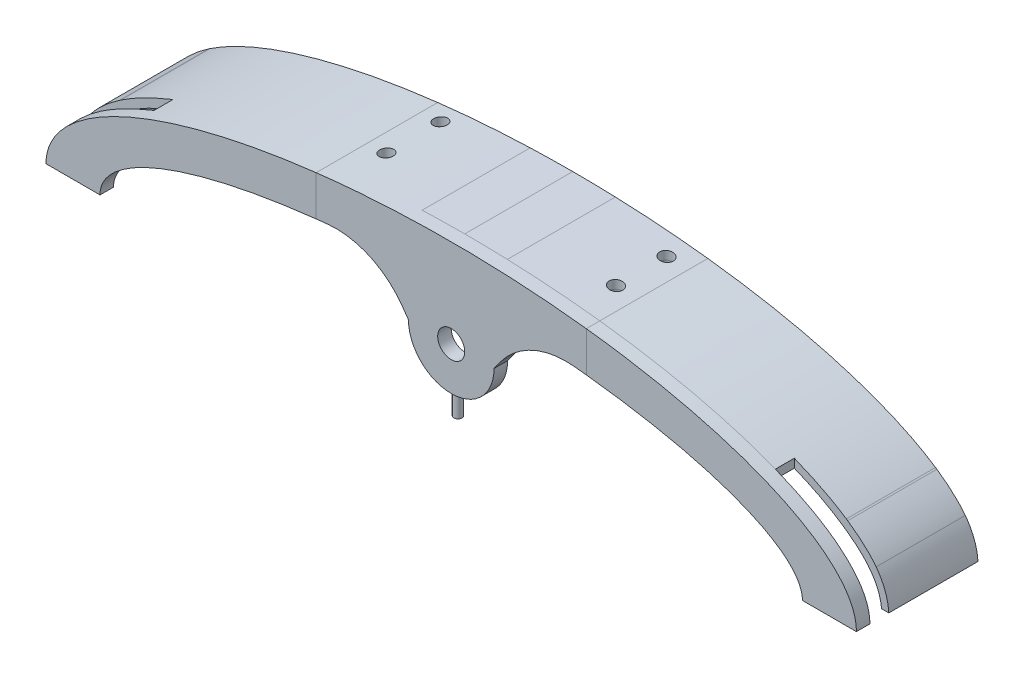
from build123d import *
from build123d.topology import SkipClean

# Parameters (mm, degrees)
ESQUISSE1_RX             = 150
ESQUISSE1_RY             = 50
BOSS_EXTRU_2_DEPTH       = 5
ESQUISSE2_RX             = 130
ESQUISSE2_RY             = 35
ENL_V_MAT_EXTRU_1_DEPTH  = 5
ESQUISSE3_W              = 338.580259568
ESQUISSE3_H              = 56.63953583
ENL_V_MAT_EXTRU_2_DEPTH  = 5
BOSS_EXTRU_3_DEPTH       = 5
CONG_1_R                 = 30
ESQUISSE5_R              = 5
ENL_V_MAT_EXTRU_3_DEPTH  = 5
BOSS_EXTRU_4_START       = -45
BOSS_EXTRU_4_DEPTH       = 40
ESQUISSE7_W              = 35
ESQUISSE7_H              = 7
ENL_V_MAT_EXTRU_5_DEPTH  = 164.09506445
BOSS_EXTRU_5_DEPTH       = 10
BOSS_EXTRU_5_DEPTH_BACK  = 7
ESQUISSE10_R             = 1.5
BOSS_EXTRU_10_REACH      = 164.2
ESQUISSE14_W             = 30
ESQUISSE14_H             = 33
BOSS_EXTRU_11_REACH      = 164.2
ESQUISSE16_W             = 30
ESQUISSE16_H             = 33
ENL_V_START              = -8.189441
ESQUISSE17_R             = 2.5
ENL_V_MAT_EXTRU_6_DEPTH  = 8.189441
FRACTIONNER2_OUTLINE_R   = 5
FRACTIONNER2_DEPTH       = 5
FRACTIONNER2_START       = -29.665741794
FRACTIONNER2_2_DEPTH     = 13.665741692
FRACTIONNER2_START_2     = -11.000004517
FRACTIONNER2_3_DEPTH     = 11.000004517
FRACTIONNER2_START_3     = -40
FRACTIONNER2_4_DEPTH     = 3.999999898
FRACTIONNER2_START_4     = -36.000000102
FRACTIONNER2_5_DEPTH     = 24.999995585
FRACTIONNER2_START_5     = 44.609756602
FRACTIONNER2_6_OUTLINE_R = 2.5
FRACTIONNER2_6_DEPTH     = 3.579684203
FRACTIONNER2_START_6     = -7
FRACTIONNER2_7_OUTLINE_R = 1.5
FRACTIONNER2_7_DEPTH     = 8.413447498
FRACTIONNER2_START_7     = -151
FRACTIONNER2_8_OUTLINE_W = 59
FRACTIONNER2_8_OUTLINE_H = 49
FRACTIONNER2_8_DEPTH     = 201
FRACTIONNER2_9_DEPTH     = 33
FRACTIONNER2_10_DEPTH    = 5
FRACTIONNER2_11_DEPTH    = 7


with BuildPart() as part:
    # Esquisse1 → Boss.-Extru.2 (new body)
    with BuildSketch(Plane.XY):
        with Locations((0, 0)):
            Ellipse(ESQUISSE1_RX, ESQUISSE1_RY)
    extrude(amount=BOSS_EXTRU_2_DEPTH)

    # Esquisse2 → Enlèv. mat.-Extru.1 (cut)
    with BuildSketch(Plane.XY.offset(5)):
        with Locations(Location((0, 0), (0, 0, 0))):
            Ellipse(ESQUISSE2_RX, ESQUISSE2_RY)
    extrude(amount=-ENL_V_MAT_EXTRU_1_DEPTH, mode=Mode.SUBTRACT)

    # Esquisse3 → Enlèv. mat.-Extru.2 (cut)
    with BuildSketch(Plane.XY.offset(5)):
        with Locations((-3.424514499, -28.319767915)):
            Rectangle(ESQUISSE3_W, ESQUISSE3_H)
    extrude(amount=-ENL_V_MAT_EXTRU_2_DEPTH, mode=Mode.SUBTRACT)

    # Esquisse4 → Boss.-Extru.3 (add)
    with BuildSketch(Plane.XY):
        with BuildLine():
            Line((15.845174987, 17.29157867), (28, 34.178525387))
            Line((28, 34.178525387), (-2.664875754, 44.275774322))
            Line((-2.664875754, 44.275774322), (-28, 34.178525387))
            Line((-28, 34.178525387), (-15.845243945, 17.095155839))
            ThreePointArc((-15.845243945, 17.095155839), (0.098211421, 1.342593988), (15.845174987, 17.29157867))
        make_face()
    extrude(amount=BOSS_EXTRU_3_DEPTH)

    # Congé1
    cong_1_edges = [part.edges().sort_by_distance(p)[0] for p in [
        (-28, 34.178525387, 2.5),
        (28, 34.178525387, 2.5),
    ]]
    fillet(cong_1_edges, radius=CONG_1_R)

    # Esquisse5 → Enlèv. mat.-Extru.3 (cut)
    with BuildSketch(Plane.XY.offset(5)):
        with Locations((0, 17.187804431)):
            Circle(ESQUISSE5_R)
    extrude(amount=-ENL_V_MAT_EXTRU_3_DEPTH, mode=Mode.SUBTRACT)

    # Boss.-Extru.4: read off the stored shape, not the designer's step
    # Boss.-Extru.4 outline → Boss.-Extru.4 (add)
    with BuildSketch(Plane.XY.offset(5).offset(BOSS_EXTRU_4_START)):
        with BuildLine():
            Line((0, 46.600242681), (0, 50))
            add(Edge.make_bspline(
                [(-15.761304085, 49.723213105), (-10.503685826, 49.900095186), (-5.247397008, 49.988568578), (0, 50)],
                knots=[0.90535686, 0.90535686, 0.90535686, 0.90535686, 1, 1, 1, 1], degree=3))
            add(Edge.make_bspline(
                [(-15.761304085, 49.723213105), (-97.594631494, 46.841036), (-134.274226107, 22.287096923)],
                knots=[1.685330257, 1.685330257, 1.685330257, 2.665492765, 2.665492765, 2.665492765], degree=2, weights=[0.96040199, 0.80429143, 0.876265347]))
            add(Edge.make_bspline(
                [(-134.779349014, 21.945708462), (-134.611328638, 22.060205738), (-134.442952588, 22.173999189), (-134.274226107, 22.287096923)],
                knots=[0.164934742, 0.164934742, 0.164934742, 0.164934742, 0.168550755, 0.168550755, 0.168550755, 0.168550755], degree=3))
            add(Edge.make_bspline(
                [(-134.779349014, 21.945708462), (-141.498923293, 17.360353105), (-145.300907362, 12.417041693)],
                knots=[2.67290709, 2.67290709, 2.67290709, 2.87528115, 2.87528115, 2.87528115], degree=2, weights=[0.877367275, 0.892583949, 0.917523824]))
            add(Edge.make_bspline(
                [(-150, 0), (-149.69407062, 4.850426726), (-147.918855057, 8.918503287), (-145.300907362, 12.417041693)],
                knots=[0, 0, 0, 0, 0.079709913, 0.079709913, 0.079709913, 0.079709913], degree=3))
            Line((-150, 0), (-147.297229878, 0))
            add(Edge.make_bspline(
                [(-147.297229878, 0), (-146.55190637, 8.121087352), (-134.103124611, 20.593757039), (-110.284334551, 31.468274657), (-65.554837533, 44.155968032), (-27.868629981, 46.563681345), (0, 46.600242681)],
                knots=[0, 0, 0, 0, 0.14174318, 0.308701525, 0.4831217, 1, 1, 1, 1], degree=3))
        make_face()
    boss_extru_4 = extrude(amount=BOSS_EXTRU_4_DEPTH)

    # Symétrie1: Boss.-Extru.4 across plane
    add(boss_extru_4.mirror(Plane(origin=(0, 0, -40), x_dir=(0, 0, 1), z_dir=(-1, 0, 0))))

    # Esquisse7 → Enlèv. mat.-Extru.5 (cut, through all)
    with BuildSketch(Plane(origin=(0, 0, 0), x_dir=(1, 0, 0), z_dir=(0, 1, 0))):
        with Locations((-132.5, 3.5)):
            Rectangle(ESQUISSE7_W, ESQUISSE7_H)
    enl_v_mat_extru_5 = extrude(amount=ENL_V_MAT_EXTRU_5_DEPTH, mode=Mode.SUBTRACT)

    # Symétrie2: Enlèv. mat.-Extru.5 across plane
    add(enl_v_mat_extru_5.mirror(Plane(origin=(0, 0, 0), x_dir=(0, 0, 1), z_dir=(1, 0, 0))), mode=Mode.SUBTRACT)

    # Esquisse10 → Boss.-Extru.5 (add, two sides: drawn at the far end of the back side and taken through both)
    with BuildSketch(Plane(origin=(0, 0, 0), x_dir=(1, 0, 0), z_dir=(0, 1, 0)).offset(-BOSS_EXTRU_5_DEPTH_BACK)):
        with Locations(Location((0, -2.5, 0), (0, 0, 270))):
            Circle(ESQUISSE10_R)
    extrude(amount=BOSS_EXTRU_5_DEPTH + BOSS_EXTRU_5_DEPTH_BACK)


with BuildPart() as body_2:

    # Esquisse14 → Boss.-Extru.10 (new, up to next)
    with BuildSketch(Plane(origin=(0, 40, 0), x_dir=(-1, 0, 0), z_dir=(0, -1, 0)), mode=Mode.PRIVATE) as boss_extru_10_sk1:
        with Locations((50, 23.5)):
            Rectangle(ESQUISSE14_W, ESQUISSE14_H)
    boss_extru_10_tool1 = extrude(boss_extru_10_sk1.sketch, amount=-BOSS_EXTRU_10_REACH, mode=Mode.PRIVATE) - part.part
    add(boss_extru_10_tool1.solids().sort_by_distance((-50, 40, -23.5))[0])


with BuildPart() as body_3:

    # Esquisse16 → Boss.-Extru.11 (new, up to next)
    with BuildSketch(Plane(origin=(0, 40, 0), x_dir=(-1, 0, 0), z_dir=(0, -1, 0)), mode=Mode.PRIVATE) as boss_extru_11_sk1:
        with Locations((-50, 23.5)):
            Rectangle(ESQUISSE16_W, ESQUISSE16_H)
    boss_extru_11_tool1 = extrude(boss_extru_11_sk1.sketch, amount=-BOSS_EXTRU_11_REACH, mode=Mode.PRIVATE) - part.part
    add(boss_extru_11_tool1.solids().sort_by_distance((50, 40, -23.5))[0])


with BuildPart() as enl_v_mat_extru_6_tool:
    # Esquisse17 → Enlèv. mat.-Extru.6 (new body)
    with BuildSketch(Plane.XZ.offset(-40).offset(ENL_V_START)):
        with Locations(Location((-42.5, -13.5, 0), (0, 0, 270))):
            Circle(ESQUISSE17_R)
        with Locations(Location((42.5, -13.5, 0), (0, 0, 270))):
            Circle(ESQUISSE17_R)
        with Locations(Location((42.5, -32.165737277, 0), (0, 0, 270))):
            Circle(ESQUISSE17_R)
        with Locations(Location((-42.5, -33.5, 0), (0, 0, 270))):
            Circle(ESQUISSE17_R)
    extrude(amount=ENL_V_MAT_EXTRU_6_DEPTH)


with BuildPart() as part_1:
    add(part.part)

    # Enlèv. mat.-Extru.6: cut by enl_v_mat_extru_6_tool
    add(enl_v_mat_extru_6_tool.part, mode=Mode.SUBTRACT)

    # Fractionner2 8 outline → Fractionner2 8 (cut)
    with BuildSketch(Plane.YZ.offset(FRACTIONNER2_START_7)):
        with Locations((22.5, -17.5)):
            Rectangle(FRACTIONNER2_8_OUTLINE_W, FRACTIONNER2_8_OUTLINE_H)
    extrude(amount=FRACTIONNER2_8_DEPTH, mode=Mode.SUBTRACT)


with BuildPart() as body_2_1:
    add(body_2.part)

    # Enlèv. mat.-Extru.6: cut by enl_v_mat_extru_6_tool
    add(enl_v_mat_extru_6_tool.part, mode=Mode.SUBTRACT)


with BuildPart() as body_3_1:
    add(body_3.part)

    # Enlèv. mat.-Extru.6: cut by enl_v_mat_extru_6_tool
    add(enl_v_mat_extru_6_tool.part, mode=Mode.SUBTRACT)


with BuildPart() as body_4:
    # Fractionner2: read off the stored shape, not the designer's step
    # Fractionner2 outline → Fractionner2 (new body)
    # profile 1 of 4: a face of its own
    with BuildSketch(Plane.XY):
        with BuildLine():
            Line((50, 44.092852893), (50, 47.140452079))
            add(Edge.make_bspline(
                [(15.761304085, 49.723213105), (33.337120261, 49.104191289), (50, 47.140452079)],
                knots=[1.676066008, 1.676066008, 1.676066008, 1.910633236, 1.910633236, 1.910633236], degree=2, weights=[1, 0.993130157, 1]))
            add(Edge.make_bspline(
                [(15.761304085, 49.723213105), (10.503685826, 49.900095186), (5.247397008, 49.988568578), (0, 50)],
                knots=[0.90535686, 0.90535686, 0.90535686, 0.90535686, 1, 1, 1, 1], degree=3))
            add(Edge.make_bspline(
                [(-15.761304085, 49.723213105), (-10.503685826, 49.900095186), (-5.247397008, 49.988568578), (0, 50)],
                knots=[0.90535686, 0.90535686, 0.90535686, 0.90535686, 1, 1, 1, 1], degree=3))
            add(Edge.make_bspline(
                [(-15.761304085, 49.723213105), (-33.337120261, 49.104191289), (-50, 47.140452079)],
                knots=[1.67514731, 1.67514731, 1.67514731, 1.910633236, 1.910633236, 1.910633236], degree=2, weights=[0.974100704, 0.980185104, 1]))
            Line((-50, 47.140452079), (-50, 44.092852893))
            add(Edge.make_bspline(
                [(-50, 44.092852893), (-33.398629858, 45.92748367), (-16.644198061, 46.578406871), (0, 46.600242681)],
                knots=[0.691300763, 0.691300763, 0.691300763, 0.691300763, 1, 1, 1, 1], degree=3))
            add(Edge.make_bspline(
                [(50, 44.092852893), (33.398629858, 45.92748367), (16.644198061, 46.578406871), (0, 46.600242681)],
                knots=[0.691300763, 0.691300763, 0.691300763, 0.691300763, 1, 1, 1, 1], degree=3))
        make_face()
    # profile 2 of 4: a face of its own
    with BuildSketch(Plane.XY):
        with BuildLine():
            Line((50, 32.307692308), (50, 44.092852893))
            add(Edge.make_bspline(
                [(50, 44.092852893), (33.398629858, 45.92748367), (16.644198061, 46.578406871), (0, 46.600242681)],
                knots=[0.691300763, 0.691300763, 0.691300763, 0.691300763, 1, 1, 1, 1], degree=3))
            add(Edge.make_bspline(
                [(-50, 44.092852893), (-33.398629858, 45.92748367), (-16.644198061, 46.578406871), (0, 46.600242681)],
                knots=[0.691300763, 0.691300763, 0.691300763, 0.691300763, 1, 1, 1, 1], degree=3))
            Line((-50, 44.092852893), (-50, 32.307692308))
            add(Edge.make_bspline(
                [(-45.59362734, 32.77681016), (-47.812693857, 32.553063189), (-50, 32.307692308)],
                knots=[1.929136381, 1.929136381, 1.929136381, 1.965587446, 1.965587446, 1.965587446], degree=2, weights=[1, 0.99983392, 1]))
            ThreePointArc((-45.59362734, 32.77681016), (-30.188335703, 30.247513293), (-18.139796917, 20.320123596))
            Line((-18.139796917, 20.320123596), (-15.845243945, 17.095155839))
            ThreePointArc((-15.845243945, 17.095155839), (0.098211422, 1.342593988), (15.845174987, 17.29157867))
            Line((15.845174987, 17.29157867), (18.128919268, 20.464431257))
            ThreePointArc((18.128919268, 20.464431257), (30.152776058, 30.290300146), (45.47858312, 32.788393309))
            add(Edge.make_bspline(
                [(50, 32.307692308), (47.755985725, 32.559424678), (45.47858312, 32.788393309)],
                knots=[1.176005207, 1.176005207, 1.176005207, 1.213401086, 1.213401086, 1.213401086], degree=2, weights=[1, 0.999825199, 1]))
        make_face()
        with Locations((0, 17.187804431)):
            Circle(FRACTIONNER2_OUTLINE_R, mode=Mode.SUBTRACT)
    # profile 3 of 4: a face of its own
    with BuildSketch(Plane.XY):
        with BuildLine():
            add(Edge.make_bspline(
                [(15.761304085, 49.723213105), (10.503685826, 49.900095186), (5.247397008, 49.988568578), (0, 50)],
                knots=[0.90535686, 0.90535686, 0.90535686, 0.90535686, 1, 1, 1, 1], degree=3))
            add(Edge.make_bspline(
                [(15.761304085, 49.723213105), (7.902525197, 50), (0, 50)],
                knots=[1.466445343, 1.466445343, 1.466445343, 1.570796327, 1.570796327, 1.570796327], degree=2, weights=[0.974100704, 0.971404521, 0.971404521]))
        make_face()
    # profile 4 of 4: a face of its own
    with BuildSketch(Plane.XY):
        with BuildLine():
            add(Edge.make_bspline(
                [(-15.761304085, 49.723213105), (-10.503685826, 49.900095186), (-5.247397008, 49.988568578), (0, 50)],
                knots=[0.90535686, 0.90535686, 0.90535686, 0.90535686, 1, 1, 1, 1], degree=3))
            add(Edge.make_bspline(
                [(0, 50), (-7.902525197, 50), (-15.761304085, 49.723213105)],
                knots=[1.570796327, 1.570796327, 1.570796327, 1.67514731, 1.67514731, 1.67514731], degree=2, weights=[0.971404521, 0.971404521, 0.974100704]))
        make_face()
    extrude(amount=FRACTIONNER2_DEPTH)

    # Fractionner2 2 outline → Fractionner2 2 (add)
    with BuildSketch(Plane.XY.offset(FRACTIONNER2_START)):
        with BuildLine():
            Line((50, 44.092852893), (50, 47.140452079))
            add(Edge.make_bspline(
                [(15.761304085, 49.723213105), (33.337120261, 49.104191289), (50, 47.140452079)],
                knots=[1.676066008, 1.676066008, 1.676066008, 1.910633236, 1.910633236, 1.910633236], degree=2, weights=[1, 0.993130157, 1]))
            add(Edge.make_bspline(
                [(15.761304085, 49.723213105), (10.503685826, 49.900095186), (5.247397008, 49.988568578), (0, 50)],
                knots=[0.90535686, 0.90535686, 0.90535686, 0.90535686, 1, 1, 1, 1], degree=3))
            add(Edge.make_bspline(
                [(-15.761304085, 49.723213105), (-10.503685826, 49.900095186), (-5.247397008, 49.988568578), (0, 50)],
                knots=[0.90535686, 0.90535686, 0.90535686, 0.90535686, 1, 1, 1, 1], degree=3))
            add(Edge.make_bspline(
                [(-15.761304085, 49.723213105), (-33.337120261, 49.104191289), (-50, 47.140452079)],
                knots=[1.67514731, 1.67514731, 1.67514731, 1.910633236, 1.910633236, 1.910633236], degree=2, weights=[0.974100704, 0.980185104, 1]))
            Line((-50, 47.140452079), (-50, 44.092852893))
            add(Edge.make_bspline(
                [(-50, 44.092852893), (-33.398629858, 45.92748367), (-16.644198061, 46.578406871), (0, 46.600242681)],
                knots=[0.691300763, 0.691300763, 0.691300763, 0.691300763, 1, 1, 1, 1], degree=3))
            add(Edge.make_bspline(
                [(50, 44.092852893), (33.398629858, 45.92748367), (16.644198061, 46.578406871), (0, 46.600242681)],
                knots=[0.691300763, 0.691300763, 0.691300763, 0.691300763, 1, 1, 1, 1], degree=3))
        make_face()
    extrude(amount=FRACTIONNER2_2_DEPTH)

    # Fractionner2 3 outline → Fractionner2 3 (add)
    with BuildSketch(Plane.XY.offset(FRACTIONNER2_START_2)):
        with BuildLine():
            Line((50, 44.092852893), (50, 47.140452079))
            add(Edge.make_bspline(
                [(15.761304085, 49.723213105), (33.337120261, 49.104191289), (50, 47.140452079)],
                knots=[1.676066008, 1.676066008, 1.676066008, 1.910633236, 1.910633236, 1.910633236], degree=2, weights=[1, 0.993130157, 1]))
            add(Edge.make_bspline(
                [(15.761304085, 49.723213105), (10.503685826, 49.900095186), (5.247397008, 49.988568578), (0, 50)],
                knots=[0.90535686, 0.90535686, 0.90535686, 0.90535686, 1, 1, 1, 1], degree=3))
            add(Edge.make_bspline(
                [(-15.761304085, 49.723213105), (-10.503685826, 49.900095186), (-5.247397008, 49.988568578), (0, 50)],
                knots=[0.90535686, 0.90535686, 0.90535686, 0.90535686, 1, 1, 1, 1], degree=3))
            add(Edge.make_bspline(
                [(-15.761304085, 49.723213105), (-33.337120261, 49.104191289), (-50, 47.140452079)],
                knots=[1.67514731, 1.67514731, 1.67514731, 1.910633236, 1.910633236, 1.910633236], degree=2, weights=[0.974100704, 0.980185104, 1]))
            Line((-50, 47.140452079), (-50, 44.092852893))
            add(Edge.make_bspline(
                [(-50, 44.092852893), (-33.398629858, 45.92748367), (-16.644198061, 46.578406871), (0, 46.600242681)],
                knots=[0.691300763, 0.691300763, 0.691300763, 0.691300763, 1, 1, 1, 1], degree=3))
            add(Edge.make_bspline(
                [(50, 44.092852893), (33.398629858, 45.92748367), (16.644198061, 46.578406871), (0, 46.600242681)],
                knots=[0.691300763, 0.691300763, 0.691300763, 0.691300763, 1, 1, 1, 1], degree=3))
        make_face()
    extrude(amount=FRACTIONNER2_3_DEPTH)

    # Fractionner2 4 outline → Fractionner2 4 (add)
    with BuildSketch(Plane.XY.offset(FRACTIONNER2_START_3)):
        with BuildLine():
            Line((50, 44.092852893), (50, 47.140452079))
            add(Edge.make_bspline(
                [(15.761304085, 49.723213105), (33.337120261, 49.104191289), (50, 47.140452079)],
                knots=[1.676066008, 1.676066008, 1.676066008, 1.910633236, 1.910633236, 1.910633236], degree=2, weights=[1, 0.993130157, 1]))
            add(Edge.make_bspline(
                [(15.761304085, 49.723213105), (10.503685826, 49.900095186), (5.247397008, 49.988568578), (0, 50)],
                knots=[0.90535686, 0.90535686, 0.90535686, 0.90535686, 1, 1, 1, 1], degree=3))
            add(Edge.make_bspline(
                [(-15.761304085, 49.723213105), (-10.503685826, 49.900095186), (-5.247397008, 49.988568578), (0, 50)],
                knots=[0.90535686, 0.90535686, 0.90535686, 0.90535686, 1, 1, 1, 1], degree=3))
            add(Edge.make_bspline(
                [(-15.761304085, 49.723213105), (-33.337120261, 49.104191289), (-50, 47.140452079)],
                knots=[1.67514731, 1.67514731, 1.67514731, 1.910633236, 1.910633236, 1.910633236], degree=2, weights=[0.974100704, 0.980185104, 1]))
            Line((-50, 47.140452079), (-50, 44.092852893))
            add(Edge.make_bspline(
                [(-50, 44.092852893), (-33.398629858, 45.92748367), (-16.644198061, 46.578406871), (0, 46.600242681)],
                knots=[0.691300763, 0.691300763, 0.691300763, 0.691300763, 1, 1, 1, 1], degree=3))
            add(Edge.make_bspline(
                [(50, 44.092852893), (33.398629858, 45.92748367), (16.644198061, 46.578406871), (0, 46.600242681)],
                knots=[0.691300763, 0.691300763, 0.691300763, 0.691300763, 1, 1, 1, 1], degree=3))
        make_face()
    extrude(amount=FRACTIONNER2_4_DEPTH)

    # Fractionner2 5 outline → Fractionner2 5 (add)
    with BuildSketch(Plane.XY.offset(FRACTIONNER2_START_4)):
        with BuildLine():
            Line((-50, 47.140452079), (-50, 44.092852893))
            add(Edge.make_bspline(
                [(-50, 44.092852893), (-33.398629858, 45.92748367), (-16.644198061, 46.578406871), (0, 46.600242681)],
                knots=[0.691300763, 0.691300763, 0.691300763, 0.691300763, 1, 1, 1, 1], degree=3))
            add(Edge.make_bspline(
                [(50, 44.092852893), (33.398629858, 45.92748367), (16.644198061, 46.578406871), (0, 46.600242681)],
                knots=[0.691300763, 0.691300763, 0.691300763, 0.691300763, 1, 1, 1, 1], degree=3))
            Line((50, 44.092852893), (50, 47.140452079))
            add(Edge.make_bspline(
                [(15.761304085, 49.723213105), (33.337120261, 49.104191289), (50, 47.140452079)],
                knots=[1.676066008, 1.676066008, 1.676066008, 1.910633236, 1.910633236, 1.910633236], degree=2, weights=[1, 0.993130157, 1]))
            add(Edge.make_bspline(
                [(15.761304085, 49.723213105), (10.503685826, 49.900095186), (5.247397008, 49.988568578), (0, 50)],
                knots=[0.90535686, 0.90535686, 0.90535686, 0.90535686, 1, 1, 1, 1], degree=3))
            add(Edge.make_bspline(
                [(-15.761304085, 49.723213105), (-10.503685826, 49.900095186), (-5.247397008, 49.988568578), (0, 50)],
                knots=[0.90535686, 0.90535686, 0.90535686, 0.90535686, 1, 1, 1, 1], degree=3))
            add(Edge.make_bspline(
                [(-15.761304085, 49.723213105), (-33.337120261, 49.104191289), (-50, 47.140452079)],
                knots=[1.67514731, 1.67514731, 1.67514731, 1.910633236, 1.910633236, 1.910633236], degree=2, weights=[0.974100704, 0.980185104, 1]))
        make_face()
    extrude(amount=FRACTIONNER2_5_DEPTH)

    # Fractionner2 6 outline → Fractionner2 6 (cut)
    with SkipClean():  # the faces are left unmerged after this step: merging them gives an invalid solid
        with BuildSketch(Plane(origin=(0, 0, 0), x_dir=(1, 0, 0), z_dir=(0, 1, 0)).offset(FRACTIONNER2_START_5)):
            with Locations((42.5, 32.165737277)):
                Circle(FRACTIONNER2_6_OUTLINE_R)
            with Locations((42.5, 13.5)):
                Circle(FRACTIONNER2_6_OUTLINE_R)
            with Locations((-42.5, 33.5)):
                Circle(FRACTIONNER2_6_OUTLINE_R)
            with Locations((-42.5, 13.5)):
                Circle(FRACTIONNER2_6_OUTLINE_R)
        extrude(amount=FRACTIONNER2_6_DEPTH, mode=Mode.SUBTRACT)

    # Fractionner2 7 outline → Fractionner2 7 (add)
    with SkipClean():  # the faces are left unmerged after this step: merging them gives an invalid solid
        with BuildSketch(Plane(origin=(0, 0, 0), x_dir=(1, 0, 0), z_dir=(0, 1, 0)).offset(FRACTIONNER2_START_6)):
            with Locations((0, -2.5)):
                Circle(FRACTIONNER2_7_OUTLINE_R)
        extrude(amount=FRACTIONNER2_7_DEPTH)


with BuildPart() as body_5:
    # Fractionner2 9 outline → Fractionner2 9 (new body)
    with BuildSketch(Plane.XY.offset(FRACTIONNER2_START_3)):
        with BuildLine():
            Line((-50, 44.092852893), (-50, 47.140452079))
            add(Edge.make_bspline(
                [(-50, 47.140452079), (-88.667645625, 42.58342634), (-115, 32.10226714)],
                knots=[1.910633236, 1.910633236, 1.910633236, 2.446980522, 2.446980522, 2.446980522], degree=2, weights=[1, 0.920044837, 0.909764976]))
            Line((-115, 32.10226714), (-115.000000001, 28.89982227))
            add(Edge.make_bspline(
                [(-115.000000001, 28.89982227), (-113.483994035, 29.514375212), (-103.161160346, 33.488790339), (-81.64321721, 39.592437434), (-61.195549839, 42.855623668), (-50, 44.092852893)],
                knots=[0.278420613, 0.278420613, 0.278420613, 0.278420613, 0.308701525, 0.4831217, 0.691300763, 0.691300763, 0.691300763, 0.691300763], degree=3))
        make_face()
        with BuildLine():
            Line((-115.000000001, 28.89982227), (-115, 32.10226714))
            add(Edge.make_bspline(
                [(-115, 32.10226714), (-126.376238095, 27.574143264), (-134.274226107, 22.287096923)],
                knots=[2.446980522, 2.446980522, 2.446980522, 2.6750063, 2.6750063, 2.6750063], degree=2, weights=[0.909764976, 0.905394537, 0.913617833]))
            add(Edge.make_bspline(
                [(-134.274226107, 22.287096923), (-134.528736828, 22.116723155), (-134.779349014, 21.945708462)],
                knots=[2.6750063, 2.6750063, 2.6750063, 2.682423285, 2.682423285, 2.682423285], degree=2, weights=[0.913617833, 0.913885312, 0.914166115]))
            add(Edge.make_bspline(
                [(-134.779349014, 21.945708462), (-141.498923293, 17.360353105), (-145.300907362, 12.417041693)],
                knots=[2.682423285, 2.682423285, 2.682423285, 2.883005835, 2.883005835, 2.883005835], degree=2, weights=[0.914166115, 0.921760062, 0.93909881]))
            add(Edge.make_bspline(
                [(-150, 0), (-149.69407062, 4.850426726), (-147.918855057, 8.918503287), (-145.300907362, 12.417041693)],
                knots=[0, 0, 0, 0, 0.079709913, 0.079709913, 0.079709913, 0.079709913], degree=3))
            Line((-150, 0), (-147.297229878, 0))
            add(Edge.make_bspline(
                [(-147.297229878, 0), (-146.55190637, 8.121087352), (-135.324240918, 19.370297536), (-121.842720036, 26.125945502), (-115.000000001, 28.89982227)],
                knots=[0, 0, 0, 0, 0.14174318, 0.278420613, 0.278420613, 0.278420613, 0.278420613], degree=3))
        make_face()
    extrude(amount=FRACTIONNER2_9_DEPTH)

    # Fractionner2 10 outline → Fractionner2 10 (add)
    with BuildSketch(Plane.XY):
        with BuildLine():
            add(Edge.make_bspline(
                [(-50, 47.140452079), (-64.230387088, 45.463384878), (-78.405373544, 43.121433139), (-91.988629582, 40.07023657), (-104.348041605, 36.342103432), (-119.528635017, 30.29971869), (-123.750460015, 28.404040822), (-127.63048675, 26.427092044), (-131.257729575, 24.316390328), (-134.477490038, 22.150703359), (-134.578515113, 22.082425137), (-137.400264525, 20.166150156), (-139.90297071, 18.208114769), (-142.010025039, 16.291702207), (-143.808192417, 14.357858564), (-147.22528418, 9.914981267), (-148.64208881, 7.401219834), (-149.558705157, 4.898136372), (-150, 2.425671674), (-150, 0)],
                knots=[1.910633236, 1.910633236, 1.910633236, 1.910633236, 1.910633236, 1.910633236, 2.446980522, 2.446980522, 2.446980522, 2.446980522, 2.6750063, 2.6750063, 2.6750063, 2.682423285, 2.682423285, 2.682423285, 2.883005835, 2.883005835, 2.883005835, 2.883005835, 3.141592654, 3.141592654, 3.141592654, 3.141592654, 3.141592654, 3.141592654], degree=5, weights=[1, 1, 0.999699787, 0.999604895, 1, 1, 0.999980912, 0.999981073, 1.000000308, 1, 1, 1.000000169, 0.99999088, 0.999991455, 1, 1, 0.999988717, 0.999991814, 1, 1]))
            Line((-150, 0), (-130, 0))
            add(Edge.make_bspline(
                [(-50, 32.307692308), (-130, 23.333333333), (-130, 0)],
                knots=[1.965587446, 1.965587446, 1.965587446, 3.141592654, 3.141592654, 3.141592654], degree=2, weights=[1, 0.832050294, 1]))
            Line((-50, 32.307692308), (-50, 47.140452079))
        make_face()
    extrude(amount=FRACTIONNER2_10_DEPTH)

    # Fractionner2 11 outline → Fractionner2 11 (add)
    with BuildSketch(Plane.XY.offset(FRACTIONNER2_START_6)):
        with BuildLine():
            Line((-50, 44.092852893), (-50, 47.140452079))
            add(Edge.make_bspline(
                [(-50, 47.140452079), (-88.667645625, 42.58342634), (-115, 32.10226714)],
                knots=[1.910633236, 1.910633236, 1.910633236, 2.446980522, 2.446980522, 2.446980522], degree=2, weights=[1, 0.920044837, 0.909764976]))
            Line((-115, 32.10226714), (-115.000000001, 28.89982227))
            add(Edge.make_bspline(
                [(-115.000000001, 28.89982227), (-113.483994035, 29.514375212), (-103.161160346, 33.488790339), (-81.64321721, 39.592437434), (-61.195549839, 42.855623668), (-50, 44.092852893)],
                knots=[0.278420613, 0.278420613, 0.278420613, 0.278420613, 0.308701525, 0.4831217, 0.691300763, 0.691300763, 0.691300763, 0.691300763], degree=3))
        make_face()
    extrude(amount=FRACTIONNER2_11_DEPTH)

    # Combiner1: union body 2
    add(body_2_1.part)


with BuildPart() as part_2:
    add(part_1.part)

    # Combiner2: union body 3
    add(body_3_1.part)


solid = Compound([body_4.part, body_5.part, part_2.part])
